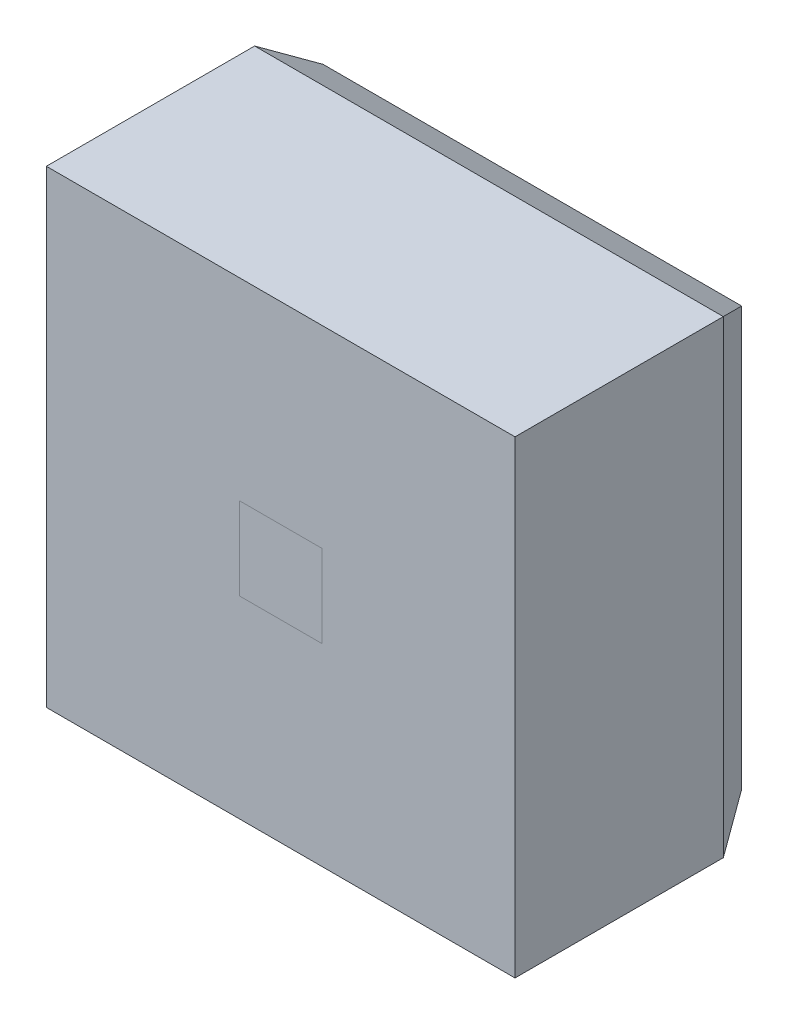
from build123d import *
from OCP.BRepFilletAPI import BRepFilletAPI_MakeChamfer

# Parameters (mm, degrees)
SKETCH2_W           = 1.08
SKETCH2_H           = 1.08
BOSS_EXTRUDE1_DEPTH = 0.68
MOVE_FACE1_BY       = 0.1
CHAMFER1_SIZE       = 0.1
CHAMFER1_SIZE2      = 0.057735027
SKETCH3_R           = 0.125
BOSS_EXTRUDE2_DEPTH = 0.1
FILLET1_R           = 0.125


with BuildPart() as part:
    # Sketch2 → Boss-Extrude1 (new body)
    with BuildSketch(Plane.XY):
        Rectangle(SKETCH2_W, SKETCH2_H)
    extrude(amount=BOSS_EXTRUDE1_DEPTH)

    # Move Face1: a face moved inward by 0.1
    extrude(part.faces().sort_by_distance((0, 0, 0))[0], amount=MOVE_FACE1_BY, dir=(0, 0, 1), mode=Mode.SUBTRACT)

    # Chamfer1: one chamfer whose edges measure the first distance from different faces: ONE call of the kernel's chamfer builder (chamfer() names one face for all edges)
    chamfer1_edges_1 = [part.edges().sort_by_distance(p)[0] for p in [
        (0, 0.54, 0.1),
    ]]
    chamfer1_side_1 = [part.faces().sort_by_distance(p)[0] for p in [
        (0, 0.54, 0.39),
    ]]
    chamfer1_edges_2 = [part.edges().sort_by_distance(p)[0] for p in [
        (0.54, 0, 0.1),
    ]]
    chamfer1_side_2 = [part.faces().sort_by_distance(p)[0] for p in [
        (0.54, 0, 0.39),
    ]]
    chamfer1_edges_3 = [part.edges().sort_by_distance(p)[0] for p in [
        (0, -0.54, 0.1),
    ]]
    chamfer1_side_3 = [part.faces().sort_by_distance(p)[0] for p in [
        (0, -0.54, 0.39),
    ]]
    chamfer1_edges_4 = [part.edges().sort_by_distance(p)[0] for p in [
        (-0.54, 0, 0.1),
    ]]
    chamfer1_side_4 = [part.faces().sort_by_distance(p)[0] for p in [
        (-0.54, 0, 0.39),
    ]]
    chamfer1 = BRepFilletAPI_MakeChamfer(part.part.solid().wrapped)
    for e in chamfer1_edges_1:
        chamfer1.Add(CHAMFER1_SIZE, CHAMFER1_SIZE2, e.wrapped, chamfer1_side_1[0].wrapped)  # the first distance lies on this face
    for e in chamfer1_edges_2:
        chamfer1.Add(CHAMFER1_SIZE, CHAMFER1_SIZE2, e.wrapped, chamfer1_side_2[0].wrapped)  # the first distance lies on this face
    for e in chamfer1_edges_3:
        chamfer1.Add(CHAMFER1_SIZE, CHAMFER1_SIZE2, e.wrapped, chamfer1_side_3[0].wrapped)  # the first distance lies on this face
    for e in chamfer1_edges_4:
        chamfer1.Add(CHAMFER1_SIZE, CHAMFER1_SIZE2, e.wrapped, chamfer1_side_4[0].wrapped)  # the first distance lies on this face
    add(Compound.cast(chamfer1.Shape()), mode=Mode.REPLACE)

    # Sketch3 → Boss-Extrude2 (add)
    with BuildSketch(Plane.XY):
        with Locations((-0.25, 0.25)):
            Circle(SKETCH3_R)
        with Locations(Location((0.25, -0.25, 0), (0, 0, 180))):
            Circle(SKETCH3_R)
        with Locations((0.25, 0.25)):
            Circle(SKETCH3_R)
        with Locations(Location((-0.25, -0.25, 0), (0, 0, 180))):
            Circle(SKETCH3_R)
    extrude(amount=BOSS_EXTRUDE2_DEPTH)

    # Fillet1
    # the kernel refuses this fillet: 0.125 mm, written as the material it takes off along each edge
    with BuildSketch(Plane(origin=(-0.25, 0.25, 0), x_dir=(1, 0, 0), z_dir=(0, -1, 0))) as fillet1_piece_1:
        with BuildLine():
            CenterArc((0.002525513, 0.125), FILLET1_R, 270, 78.463040967)
            Line((0.002525513, 0), (0.002525513, -0.0025))
            Line((0.002525513, -0.0025), (0.125, -0.0025))
            Line((0.125, -0.0025), (0.1275, 0))
            ThreePointArc((0.1275, 0), (0.1275, 0.05), (0.12744949, 0.0995))
            Line((0.12744949, 0.0995), (0.125, 0.1))
        make_face()
    revolve(axis=Axis((-0.25, 0.25, 0), (0, 0, 1)), mode=Mode.SUBTRACT)
    with BuildSketch(Plane(origin=(0.25, -0.25, 0), x_dir=(-1, 0, 0), z_dir=(0, 1, 0))) as fillet1_piece_2:
        with BuildLine():
            CenterArc((0.002525513, 0.125), FILLET1_R, 270, 78.463040967)
            Line((0.002525513, 0), (0.002525513, -0.0025))
            Line((0.002525513, -0.0025), (0.125, -0.0025))
            Line((0.125, -0.0025), (0.1275, 0))
            ThreePointArc((0.1275, 0), (0.1275, 0.05), (0.12744949, 0.0995))
            Line((0.12744949, 0.0995), (0.125, 0.1))
        make_face()
    revolve(axis=Axis((0.25, -0.25, 0), (0, 0, 1)), mode=Mode.SUBTRACT)
    with BuildSketch(Plane(origin=(0.25, 0.25, 0), x_dir=(1, 0, 0), z_dir=(0, -1, 0))) as fillet1_piece_3:
        with BuildLine():
            CenterArc((0.002525513, 0.125), FILLET1_R, 270, 78.463040967)
            Line((0.002525513, 0), (0.002525513, -0.0025))
            Line((0.002525513, -0.0025), (0.125, -0.0025))
            Line((0.125, -0.0025), (0.1275, 0))
            ThreePointArc((0.1275, 0), (0.1275, 0.05), (0.12744949, 0.0995))
            Line((0.12744949, 0.0995), (0.125, 0.1))
        make_face()
    revolve(axis=Axis((0.25, 0.25, 0), (0, 0, 1)), mode=Mode.SUBTRACT)
    with BuildSketch(Plane(origin=(-0.25, -0.25, 0), x_dir=(-1, 0, 0), z_dir=(0, 1, 0))) as fillet1_piece_4:
        with BuildLine():
            CenterArc((0.002525513, 0.125), FILLET1_R, 270, 78.463040967)
            Line((0.002525513, 0), (0.002525513, -0.0025))
            Line((0.002525513, -0.0025), (0.125, -0.0025))
            Line((0.125, -0.0025), (0.1275, 0))
            ThreePointArc((0.1275, 0), (0.1275, 0.05), (0.12744949, 0.0995))
            Line((0.12744949, 0.0995), (0.125, 0.1))
        make_face()
    revolve(axis=Axis((-0.25, -0.25, 0), (0, 0, 1)), mode=Mode.SUBTRACT)


solid = part.part
